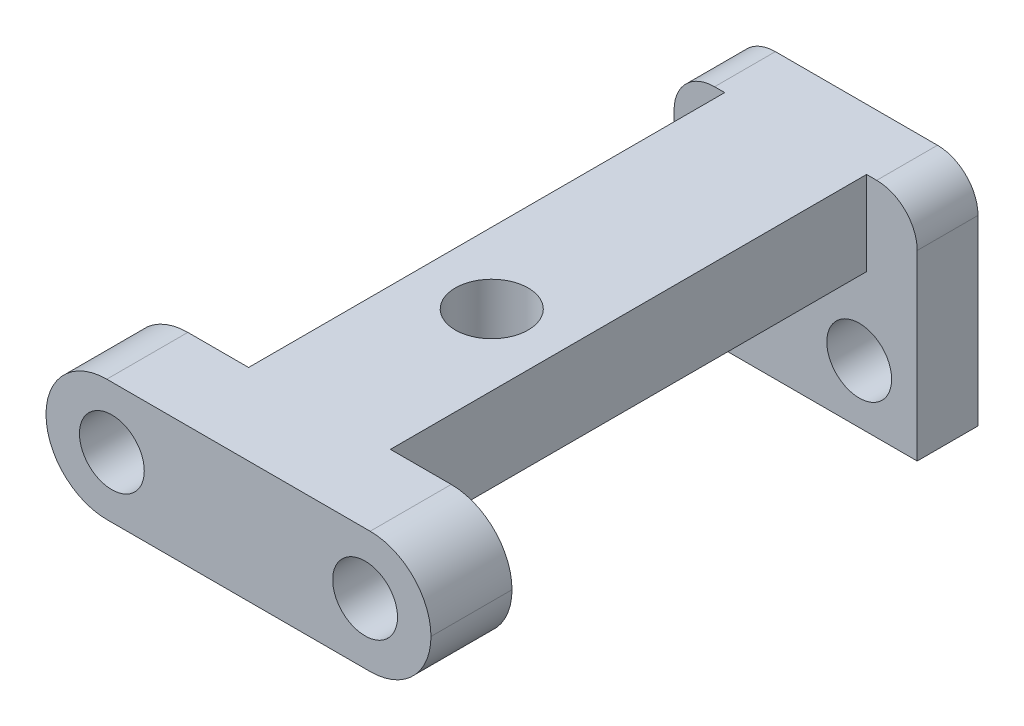
from build123d import *

# Parameters (mm, degrees)
BOSS_EXTRUDE1_DEPTH      = 27.5
BOSS_EXTRUDE2_START      = 3
BOSS_EXTRUDE2_DEPTH      = 3
SKETCH3_W                = 19
SKETCH3_H                = 6
BOSS_EXTRUDE3_DEPTH      = 4
M3_CLEARANCE_HOLE1_D     = 3.2
M3_CLEARANCE_HOLE1_DEPTH = 4
FILLET1_R                = 3
M3_CLEARANCE_HOLE2_D     = 3.6
FILLET2_R                = 2


with BuildPart() as part:
    # Sketch1 → Boss-Extrude1 (new body)
    with BuildSketch(Plane.XY):
        with BuildLine():
            Line((-3.5, 44), (-3.5, 39.846580782))
            ThreePointArc((-3.5, 39.846580782), (0, 40), (3.5, 39.846580782))
            Line((3.5, 39.846580782), (3.5, 44))
            Line((3.5, 44), (-3.5, 44))
        make_face()
    extrude(amount=BOSS_EXTRUDE1_DEPTH)

    # Sketch2 → Boss-Extrude2 (add)
    with BuildSketch(Plane(origin=(0, 0, 0), x_dir=(-1, 0, 0), z_dir=(0, 0, -1)).offset(BOSS_EXTRUDE2_START)):
        with BuildLine():
            ThreePointArc((-4.728025778, 35.688174123), (-5.364869156, 35.598008075), (-6, 35.496478699))
            Line((-6, 35.496478699), (-6, 33))
            Line((-6, 33), (6, 33))
            Line((6, 33), (6, 35.496478699))
            ThreePointArc((6, 35.496478699), (5.364869156, 35.598008075), (4.728025778, 35.688174123))
            ThreePointArc((4.728025778, 35.688174123), (2.998157551, 34.269097614), (1.540989958, 35.967003628))
            ThreePointArc((1.540989958, 35.967003628), (0, 36), (-1.540989958, 35.967003628))
            ThreePointArc((-1.540989958, 35.967003628), (-1.538452767, 35.915033888), (-1.537606739, 35.863009131))
            ThreePointArc((-1.537606739, 35.863009131), (-3.050058074, 34.265406167), (-4.728025778, 35.688174123))
        make_face()
        with BuildLine():
            Line((-3.5, 44), (-6, 44))
            Line((-6, 44), (-6, 35.496478699))
            ThreePointArc((-6, 35.496478699), (-5.364869156, 35.598008075), (-4.728025778, 35.688174123))
            ThreePointArc((-4.728025778, 35.688174123), (-3.277055927, 37.456920648), (-1.540989958, 35.967003628))
            ThreePointArc((-1.540989958, 35.967003628), (0, 36), (1.540989958, 35.967003628))
            ThreePointArc((1.540989958, 35.967003628), (3.189631496, 37.462163103), (4.737606739, 35.863009131))
            ThreePointArc((4.737606739, 35.863009131), (4.735209703, 35.775460466), (4.728025778, 35.688174123))
            ThreePointArc((4.728025778, 35.688174123), (5.364869156, 35.598008075), (6, 35.496478699))
            Line((6, 35.496478699), (6, 44))
            Line((6, 44), (3.5, 44))
            Line((3.5, 44), (3.5, 39.846580782))
            ThreePointArc((3.5, 39.846580782), (0, 40), (-3.5, 39.846580782))
            Line((-3.5, 39.846580782), (-3.5, 44))
        make_face()
        with BuildLine():
            Line((-3.5, 44), (-3.5, 39.846580782))
            ThreePointArc((-3.5, 39.846580782), (0, 40), (3.5, 39.846580782))
            Line((3.5, 39.846580782), (3.5, 44))
            Line((3.5, 44), (-3.5, 44))
        make_face()
    extrude(amount=-BOSS_EXTRUDE2_DEPTH)

    # Sketch3 → Boss-Extrude3 (add)
    with BuildSketch(Plane.XY.offset(27.5)):
        with Locations((0, 41)):
            Rectangle(SKETCH3_W, SKETCH3_H)
    extrude(amount=-BOSS_EXTRUDE3_DEPTH)

    # M3 Clearance Hole1
    with Locations(Plane.XY.offset(27.5)):
        with Locations((-6.25, 41), (6.25, 41)):
            Hole(M3_CLEARANCE_HOLE1_D / 2, depth=M3_CLEARANCE_HOLE1_DEPTH)

    # Fillet1
    fillet1_edges = [part.edges().sort_by_distance(p)[0] for p in [
        (9.5, 38, 25.5),
        (9.5, 44, 25.5),
        (-9.5, 38, 25.5),
        (-9.5, 44, 25.5),
    ]]
    fillet(fillet1_edges, radius=FILLET1_R - 0.0001)  # a hair under: the kernel refuses the full size

    # M3 Clearance Hole2 (through all)
    with Locations(Plane(origin=(0, 44, 0), x_dir=(1, 0, 0), z_dir=(0, 1, 0))):
        with Locations((0, -15)):
            Hole(M3_CLEARANCE_HOLE2_D / 2)

    # Fillet2
    fillet2_edges = [part.edges().sort_by_distance(p)[0] for p in [
        (-6, 44, -1.5),
        (6, 44, -1.5),
    ]]
    fillet(fillet2_edges, radius=FILLET2_R)


solid = part.part
